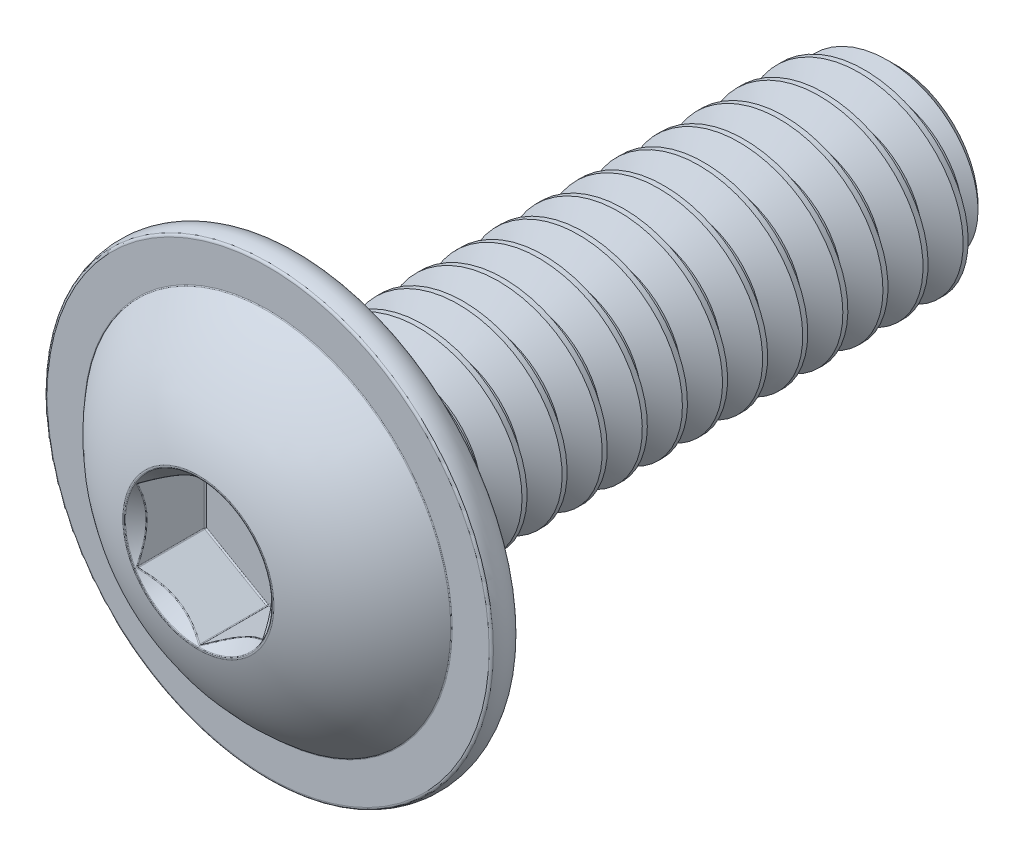
from build123d import *

# Parameters (mm, degrees)
CUT_EXTRUDE1_DEPTH = 2.2098
SKETCH5_R          = 2.331046381
CUT_EXTRUDE2_DEPTH = 2.2098
CUT_EXTRUDE2_DRAFT = -45
FILLET3_R          = 0.0396875
FILLET4_R          = 0.0889
CUT_SWEEP1_PITCH   = 1.27
CUT_SWEEP1_TO      = 18.542


with BuildPart() as part:
    # Sketch3 → Revolve1 (revolve)
    with BuildSketch(Plane(origin=(0, 0, 0), x_dir=(0, 0, -1), z_dir=(1, 0, 0)), mode=Mode.PRIVATE) as revolve1_sk:
        with BuildLine():
            Line((-11.0744, 0), (-11.0744, 2.390577631))
            ThreePointArc((-11.0744, 2.390577631), (-10.252204286, 4.283097963), (-8.8646, 5.81025))
            Line((-8.8646, 5.81025), (-8.8646, 7.05485))
            ThreePointArc((-8.8646, 7.05485), (-8.407178544, 7.13961456), (-7.9756, 6.96595))
            Line((-7.9756, 6.96595), (-7.9756, 3.683))
            ThreePointArc((-7.9756, 3.683), (-7.826810245, 3.323789755), (-7.4676, 3.175))
            Line((-7.4676, 3.175), (10.4394, 3.175))
            Line((10.4394, 3.175), (11.0744, 2.54))
            Line((11.0744, 2.54), (11.0744, 0))
            Line((11.0744, 0), (-11.0744, 0))
        make_face()
    revolve(revolve1_sk.sketch.rotate(Axis((0, 0, -11.0744), (0, 0, 1)), 90), axis=Axis((0, 0, -11.0744), (0, 0, 1)))

    # Sketch4 → Cut-Extrude1 (cut)
    with BuildSketch(Plane.XY.offset(11.0744)):
        Polygon((0, 2.291358881), (-1.984375, 1.14567944), (-1.984375, -1.14567944), (0, -2.291358881), (1.984375, -1.14567944), (1.984375, 1.14567944), align=None)
    extrude(amount=-CUT_EXTRUDE1_DEPTH, mode=Mode.SUBTRACT)


with BuildPart() as cut_extrude2_tool:
    # Sketch5 → Cut-Extrude2 (with draft: the straight prism first)
    with BuildSketch(Plane.XY.offset(11.0744)):
        Circle(SKETCH5_R)
    extrude(amount=-CUT_EXTRUDE2_DEPTH)
    # Cut-Extrude2: the draft: its side faces are tilted about the plane it starts from
    cut_extrude2_sides = [cut_extrude2_tool.faces().sort_by_distance(p)[0] for p in [
        (-2.331046381, 0, 9.9695),
    ]]
    draft(cut_extrude2_sides, Plane.XY.offset(11.0744), CUT_EXTRUDE2_DRAFT)


with BuildPart() as part_1:
    add(part.part)

    # Cut-Extrude2: cut by cut_extrude2_tool
    add(cut_extrude2_tool.part, mode=Mode.SUBTRACT)

    # Fillet3
    fillet3_edges = [part_1.edges().sort_by_distance(p)[0] for p in [
        (0, 2.291358881, 9.94965625),
        (1.984375, 1.14567944, 9.94965625),
        (1.984375, -1.14567944, 9.94965625),
        (0, -2.291358881, 9.94965625),
        (-1.984375, -1.14567944, 9.94965625),
        (-1.984375, 1.14567944, 9.94965625),
        (0.9921875, 1.718519161, 8.8646),
        (1.984375, 0, 8.8646),
        (0.9921875, -1.718519161, 8.8646),
        (-0.9921875, -1.718519161, 8.8646),
        (-1.984375, 0, 8.8646),
        (-0.9921875, 1.718519161, 8.8646),
        (-2.331046381, 0, 11.0744),
        (1.984375, -0.5903679, 10.813686539),
        (0.9921875, 1.718519161, 10.727728619),
        (-0.9921875, 1.718519161, 10.727728619),
        (-1.984375, 0, 10.727728619),
        (-0.9921875, -1.718519161, 10.727728619),
        (0.9921875, -1.718519161, 10.727728619),
        (2.390577631, 0, 11.0744),
        (5.81025, 0, 8.8646),
    ]]
    fillet(fillet3_edges, radius=FILLET3_R)

    # Fillet4
    fillet4_edges = [part_1.edges().sort_by_distance(p)[0] for p in [
        (7.05485, 0, 8.8646),
        (6.96595, 0, 7.9756),
    ]]
    fillet(fillet4_edges, radius=FILLET4_R)


with BuildPart() as body_2:
    # Split1: the piece on the far side of the plane
    add(part_1.part)
    split(bisect_by=Plane.XY.offset(7.4676), keep=Keep.BOTTOM)

    # Cut-Sweep1: arcs per turn and ends read off the stored shape
    # Cut-Sweep1: the profile of Sketch7 screwed along a right-hand helix through 16.5 turns, 8 arcs to a turn; built about Z, then put on its axis
    cut_sweep1_z = Axis((0, 0, 0), (0, 0, 1))
    cut_sweep1_corners = [(3.243740766, 0, 0.0396875), (3.243740766, 0, -1.1509375), (2.350110803, 0, -0.635), (2.350110803, 0, -0.47625)]
    with BuildLine(mode=Mode.PRIVATE) as cut_sweep1_profile:
        Line(cut_sweep1_corners[0], cut_sweep1_corners[1])
        Line(cut_sweep1_corners[1], cut_sweep1_corners[2])
        Line(cut_sweep1_corners[2], cut_sweep1_corners[3])
        Line(cut_sweep1_corners[3], cut_sweep1_corners[0])
    cut_sweep1_cap = Face(cut_sweep1_profile.wire())
    cut_sweep1_turn_angles = [0, 22.5, 45, 67.5, 90, 112.5, 135, 157.5, 180, 202.5, 225, 247.5, 270, 292.5, 315, 337.5, 360]
    cut_sweep1_turn_weights = [1, 0.9238795325112867, 1, 0.9238795325112867, 1, 0.9238795325112867, 1, 0.9238795325112867, 1, 0.9238795325112867, 1, 0.9238795325112867, 1, 0.9238795325112867, 1, 0.9238795325112867, 1]
    cut_sweep1_turn_rails = [Edge.make_bspline([Vector(p[0], p[1], 0).rotate(cut_sweep1_z, cut_sweep1_turn_angles[k]) / cut_sweep1_turn_weights[k] + Vector(0, 0, p[2] + CUT_SWEEP1_PITCH * cut_sweep1_turn_angles[k] / 360) for k in range(17)], [0, 0, 0, 1, 1, 2, 2, 3, 3, 4, 4, 5, 5, 6, 6, 7, 7, 8, 8, 8], 2, cut_sweep1_turn_weights) for p in cut_sweep1_corners]
    cut_sweep1_turn_sides = [Face.make_surface_from_curves(cut_sweep1_turn_rails[p[0]], cut_sweep1_turn_rails[p[1]]) for p in [(0, 1), (1, 2), (2, 3), (3, 0)]]
    cut_sweep1_last_angles = [5760, 5782.5, 5805, 5827.5, 5850, 5872.5, 5895, 5917.5, 5940]
    cut_sweep1_last_weights = [1, 0.9238795325112867, 1, 0.9238795325112867, 1, 0.9238795325112867, 1, 0.9238795325112685, 1]
    cut_sweep1_last_rails = [Edge.make_bspline([Vector(p[0], p[1], 0).rotate(cut_sweep1_z, cut_sweep1_last_angles[k]) / cut_sweep1_last_weights[k] + Vector(0, 0, p[2] + CUT_SWEEP1_PITCH * cut_sweep1_last_angles[k] / 360) for k in range(9)], [0, 0, 0, 1, 1, 2, 2, 3, 3, 4, 4, 4], 2, cut_sweep1_last_weights) for p in cut_sweep1_corners]
    cut_sweep1_last_sides = [Face.make_surface_from_curves(cut_sweep1_last_rails[p[0]], cut_sweep1_last_rails[p[1]]) for p in [(0, 1), (1, 2), (2, 3), (3, 0)]]
    cut_sweep1 = Plane(origin=(0, 0, -11.0744), x_dir=(0, 1, 0), z_dir=(0, 0, 1)) * split(Solid(Shell([*[p.moved(Location((0, 0, CUT_SWEEP1_PITCH * i))) for i in range(16) for p in cut_sweep1_turn_sides], *cut_sweep1_last_sides, cut_sweep1_cap, cut_sweep1_cap.rotate(cut_sweep1_z, 5940).moved(Location((0, 0, CUT_SWEEP1_PITCH * 5940 / 360)))])), bisect_by=Plane.XY.offset(CUT_SWEEP1_TO), keep=Keep.BOTTOM, mode=Mode.PRIVATE)
    add(cut_sweep1, mode=Mode.SUBTRACT)


with BuildPart() as part_2:
    add(part_1.part)

    # Split1
    split(bisect_by=Plane.XY.offset(7.4676), keep=Keep.TOP)

    add(body_2.part)  # Boss-Extrude1 merges body 2
    # Boss-Extrude1 cone 1 section (through the dimple's axis) → Boss-Extrude1 (revolve)
    with BuildSketch(Plane(origin=(0, 0, 7.4676), x_dir=(0, -1, 0), z_dir=(1, 0, 0))):
        Polygon((0, 0), (3.175, 0), (0, 3.175), align=None)
    revolve(axis=Axis((0, 0, 7.4676), (0, 0, -1)))


solid = part_2.part
